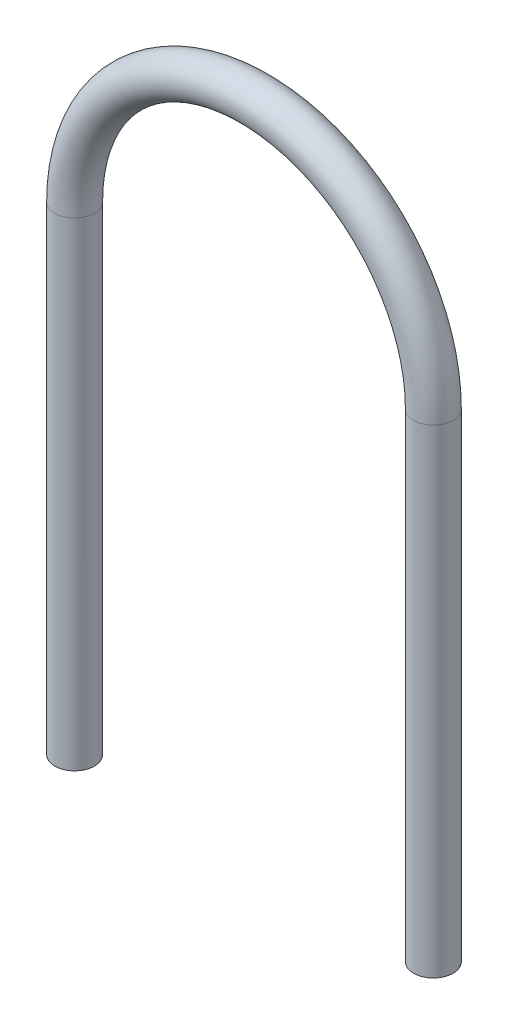
from build123d import *

# Parameters (mm, degrees)
SKETCH2_R = 3.1496


with BuildPart() as part:
    # Sweep1: sweep along a path in Sketch1
    with BuildLine(Plane.XY) as sweep1_path:
        Line((0, 0), (0, 76.2))
        ThreePointArc((0, 76.2), (-25.4, 101.6), (-50.8, 76.2))
        Line((-50.8, 76.2), (-50.8, 0))
    # Sketch2 → Sweep1 (sweep)
    with BuildSketch(Plane(origin=(0, 0, 0), x_dir=(1, 0, 0), z_dir=(0, 1, 0))):
        with Locations((3.1496, 0)):
            Circle(SKETCH2_R)
    sweep(path=sweep1_path.line)


solid = part.part
